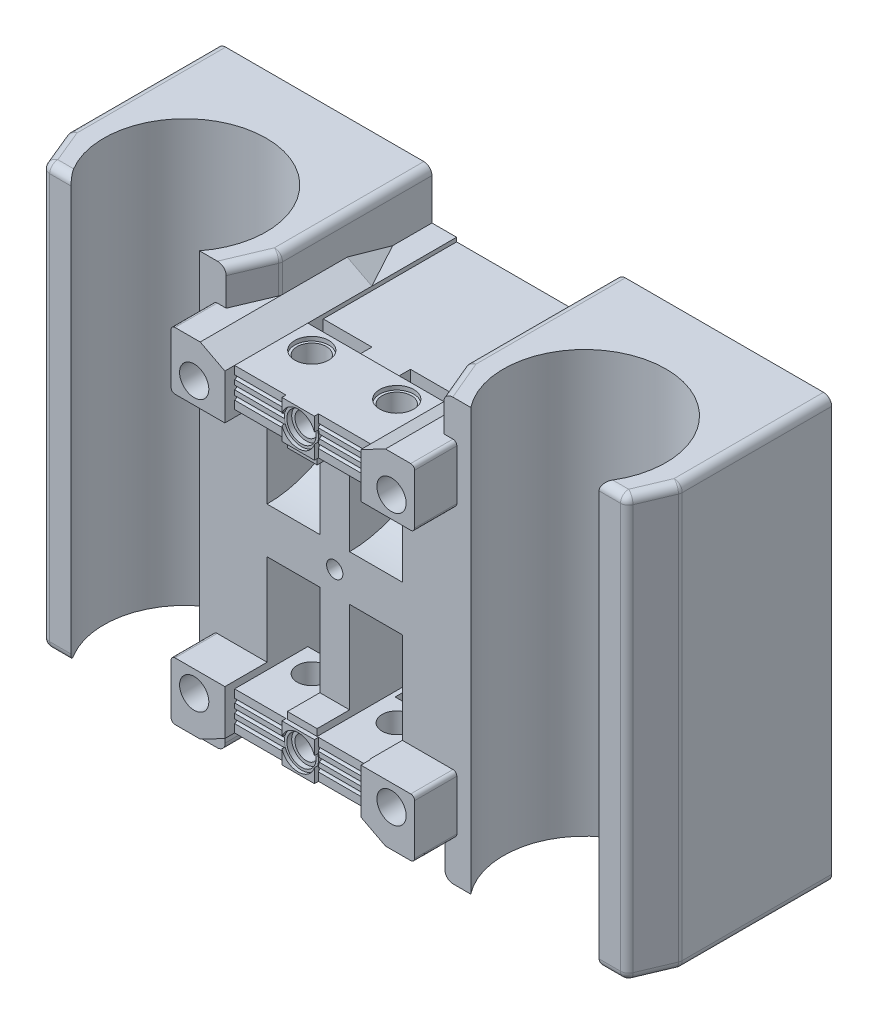
from build123d import *

# Parameters (mm, degrees)
BOSS_EXTRUDE1_DEPTH     = 300
SKETCH3_W               = 65
SKETCH3_H               = 5
CUT_EXTRUDE1_DEPTH      = 7
SKETCH4_R               = 10
SKETCH4_R_2             = 14
SKETCH4_W               = 65
SKETCH4_H               = 120.911733939
CUT_EXTRUDE2_DEPTH      = 200
BOSS_EXTRUDE2_DEPTH     = 12
CUT_EXTRUDE4_DEPTH      = 1618.985651132
CUT_EXTRUDE4_DEPTH_BACK = 1618.985651132
SKETCH8_R               = 18
SKETCH9_W               = 40
SKETCH9_H               = 47
SKETCH9_R               = 19.5
BOSS_EXTRUDE6_DEPTH     = 5
SKETCH10_R              = 21
CUT_EXTRUDE6_DEPTH      = 10
SKETCH12_W              = 40
SKETCH12_H              = 281.169421229
CUT_EXTRUDE7_DEPTH      = 664
SKETCH13_W              = 184.056183541
SKETCH13_H              = 44.770423024
SKETCH13_W_2            = 184.056183542
CUT_EXTRUDE8_DEPTH      = 40
CUT_EXTRUDE9_START      = -40
CUT_EXTRUDE9_DEPTH      = 40
CUT_EXTRUDE10_START     = -40
CUT_EXTRUDE10_DEPTH     = 40
SKETCH17_W              = 260
SKETCH17_H              = 519.04990449
BOSS_EXTRUDE8_DEPTH     = 80
SKETCH18_W              = 260
SKETCH18_H              = 519.04990449
BOSS_EXTRUDE9_DEPTH     = 80
CUT_EXTRUDE13_DEPTH     = 44.770423024
CUT_EXTRUDE14_DEPTH     = 44.770423024
CUT_EXTRUDE15_DEPTH     = 1555.226022996
CUT_EXTRUDE18_DEPTH     = 1555.226022996
SKETCH21_W              = 260
SKETCH21_H              = 46.726362612
BOSS_EXTRUDE10_DEPTH    = 10
SKETCH22_W              = 260
SKETCH22_H              = 46.726362612
BOSS_EXTRUDE11_DEPTH    = 10
SKETCH23_W              = 167.481150758
SKETCH23_H              = 209.837877549
CUT_EXTRUDE19_DEPTH     = 5
SKETCH24_R              = 18
CUT_EXTRUDE20_DEPTH     = 425
SKETCH25_R              = 21
CUT_EXTRUDE21_DEPTH     = 5
CUT_EXTRUDE22_START     = -5
SKETCH26_R              = 21
CUT_EXTRUDE22_DEPTH     = 5
BOSS_EXTRUDE12_START    = 6
SKETCH28_R              = 21
SKETCH28_R_2            = 18
BOSS_EXTRUDE12_DEPTH    = 6
BOSS_EXTRUDE13_START    = 6
SKETCH29_R              = 21
SKETCH29_R_2            = 18
BOSS_EXTRUDE13_DEPTH    = 6
SKETCH30_R              = 10
CUT_EXTRUDE23_DEPTH     = 1672.95786284
CUT_EXTRUDE24_DEPTH     = 131
SKETCH33_W              = 30.337968043
SKETCH33_H              = 5
BOSS_EXTRUDE14_DEPTH    = 131
SKETCH37_W              = 65
SKETCH37_H              = 160
BOSS_EXTRUDE15_DEPTH    = 56.143010748
BOSS_EXTRUDE17_DEPTH    = 166.601474
SKETCH41_W              = 60.040287367
SKETCH41_H              = 18.955516772
SKETCH41_W_2            = 60.040287366
CUT_EXTRUDE25_DEPTH     = 527
BOSS_EXTRUDE18_DEPTH    = 113.5
SKETCH46_R              = 12.5
CUT_EXTRUDE26_DEPTH     = 15
SKETCH48_R              = 12.5
CUT_EXTRUDE27_DEPTH     = 313
SKETCH49_W              = 756.269453926
SKETCH49_H              = 26.627610499
CUT_EXTRUDE28_DEPTH     = 710
BOSS_EXTRUDE19_REACH    = 1008.136
SKETCH51_R              = 18
CUT_EXTRUDE29_DEPTH     = 6
SKETCH52_R              = 14
CUT_EXTRUDE30_DEPTH     = 150
BOSS_EXTRUDE20_REACH    = 1008.136
SKETCH54_R              = 18
CUT_EXTRUDE31_DEPTH     = 6
SKETCH55_R              = 14
CUT_EXTRUDE32_DEPTH     = 175
FILLET1_R               = 10
FILLET2_R               = 10
FILLET3_R               = 10
FILLET4_R               = 10
FILLET5_R               = 10
FILLET6_R               = 10
FILLET7_R               = 10
FILLET8_R               = 10
FILLET9_R               = 10
FILLET10_R              = 10
FILLET11_R              = 10
FILLET12_R              = 10
FILLET13_R              = 10
FILLET14_R              = 10


with BuildPart() as part:
    # Sketch2 → Boss-Extrude1 (new body)
    with BuildSketch(Plane.XY):
        Polygon((969.509246689, 777.089695661), (1136.990397447, 777.089695661), (1167.32836549, 792.867546452), (1167.32836549, 837.637969476), (1351.384549031, 837.637969476), (1351.384549031, 318.588064986), (1198.532308906, 318.588064986), (1198.532308906, 365.314427598), (1173.137546617, 365.314427598), (1136.990397447, 385.122342183), (969.509246689, 385.122342183), (933.362097519, 365.314427598), (907.967335231, 365.314427598), (907.967335231, 318.588064986), (755.115095105, 318.588064986), (755.115095105, 837.637969476), (939.171278647, 837.637969476), (939.171278647, 792.867546452), align=None)
    extrude(amount=BOSS_EXTRUDE1_DEPTH)

    # Sketch3 → Cut-Extrude1 (cut)
    with BuildSketch(Plane.XY.offset(300)):
        with Locations((1002.009246689, 764.589695661)):
            Rectangle(SKETCH3_W, SKETCH3_H)
        with Locations((1002.009246689, 753.589695661)):
            Rectangle(SKETCH3_W, SKETCH3_H)
        with Locations((1002.009246689, 742.589695661)):
            Rectangle(SKETCH3_W, SKETCH3_H)
        with Locations((1002.009246689, 419.622342183)):
            Rectangle(SKETCH3_W, SKETCH3_H)
        with Locations((1002.009246689, 408.622342183)):
            Rectangle(SKETCH3_W, SKETCH3_H)
        with Locations((1002.009246689, 397.622342183)):
            Rectangle(SKETCH3_W, SKETCH3_H)
        with Locations((1104.490397447, 742.589695661)):
            Rectangle(SKETCH3_W, SKETCH3_H)
        with Locations((1104.490397447, 753.589695661)):
            Rectangle(SKETCH3_W, SKETCH3_H)
        with Locations((1104.490397447, 764.589695661)):
            Rectangle(SKETCH3_W, SKETCH3_H)
        with Locations((1104.490397447, 397.622342183)):
            Rectangle(SKETCH3_W, SKETCH3_H)
        with Locations((1104.490397447, 408.622342183)):
            Rectangle(SKETCH3_W, SKETCH3_H)
        with Locations((1104.490397447, 419.622342183)):
            Rectangle(SKETCH3_W, SKETCH3_H)
    extrude(amount=-CUT_EXTRUDE1_DEPTH, mode=Mode.SUBTRACT)

    # Sketch4 → Cut-Extrude2 (cut)
    with BuildSketch(Plane.XY.offset(300)):
        with Locations((1052.809983699, 581.106018922)):
            Circle(SKETCH4_R)
        with Locations((1052.809983699, 753.589695661)):
            Circle(SKETCH4_R_2)
        with Locations(Location((1052.809983699, 408.622342183, 0), (0, 0, 180))):
            Circle(SKETCH4_R_2)
        with Locations((1002.009246689, 669.633391265)):
            Rectangle(SKETCH4_W, SKETCH4_H)
        with Locations((1002.009246689, 492.578646579)):
            Rectangle(SKETCH4_W, SKETCH4_H)
        with Locations((1103.610720709, 492.578646579)):
            Rectangle(SKETCH4_W, SKETCH4_H)
        with Locations((1103.610720709, 669.633391265)):
            Rectangle(SKETCH4_W, SKETCH4_H)
    extrude(amount=-CUT_EXTRUDE2_DEPTH, mode=Mode.SUBTRACT)

    # Sketch7 → Boss-Extrude2 (add)
    with BuildSketch(Plane.XY.offset(300)):
        with BuildLine():
            Line((969.509246689, 777.089695661), (939.171278647, 792.867546452))
            Line((939.171278647, 792.867546452), (908.104391404, 792.867546452))
            ThreePointArc((908.104391404, 792.867546452), (904.728387769, 791.46915996), (903.330001277, 788.093156325))
            Line((903.330001277, 788.093156325), (903.330001277, 726.465119664))
            ThreePointArc((903.330001277, 726.465119664), (904.728387769, 723.089116029), (908.104391404, 721.690729537))
            Line((908.104391404, 721.690729537), (969.509246689, 721.690729537))
            Line((969.509246689, 721.690729537), (969.509246689, 777.089695661))
        make_face()
        with BuildLine():
            Line((1136.990397447, 777.089695661), (1167.32836549, 792.867546452))
            Line((1167.32836549, 792.867546452), (1198.395252733, 792.867546452))
            ThreePointArc((1198.395252733, 792.867546452), (1201.771256368, 791.46915996), (1203.16964286, 788.093156325))
            Line((1203.16964286, 788.093156325), (1203.16964286, 726.465119664))
            ThreePointArc((1203.16964286, 726.465119664), (1201.771256368, 723.089116029), (1198.395252733, 721.690729537))
            Line((1198.395252733, 721.690729537), (1136.990397447, 721.690729537))
            Line((1136.990397447, 721.690729537), (1136.990397447, 777.089695661))
        make_face()
        with BuildLine():
            Line((1136.990397447, 440.521308308), (1136.990397447, 385.122342183))
            Line((1136.990397447, 385.122342183), (1167.32836549, 369.344491392))
            Line((1167.32836549, 369.344491392), (1198.395252733, 369.344491392))
            ThreePointArc((1198.395252733, 369.344491392), (1201.771256368, 370.742877884), (1203.16964286, 374.118881519))
            Line((1203.16964286, 374.118881519), (1203.16964286, 435.74691818))
            ThreePointArc((1203.16964286, 435.74691818), (1201.771256368, 439.122921815), (1198.395252733, 440.521308308))
            Line((1198.395252733, 440.521308308), (1136.990397447, 440.521308308))
        make_face()
        with BuildLine():
            Line((903.330001277, 374.118881519), (903.330001277, 435.74691818))
            ThreePointArc((903.330001277, 435.74691818), (904.728387769, 439.122921815), (908.104391404, 440.521308308))
            Line((908.104391404, 440.521308308), (969.509246689, 440.521308308))
            Line((969.509246689, 440.521308308), (969.509246689, 385.122342183))
            Line((969.509246689, 385.122342183), (939.171278647, 369.344491392))
            Line((939.171278647, 369.344491392), (908.104391404, 369.344491392))
            ThreePointArc((908.104391404, 369.344491392), (904.728387769, 370.742877884), (903.330001277, 374.118881519))
        make_face()
    extrude(amount=BOSS_EXTRUDE2_DEPTH)

    # Sketch8 → Cut-Extrude4 (cut, two sides: drawn at the far end of the back side and taken through both)
    with BuildSketch(Plane.XY.offset(300).offset(-CUT_EXTRUDE4_DEPTH_BACK)):
        with Locations((931.755805763, 747.752371261)):
            Circle(SKETCH8_R)
        with Locations(Location((931.755805763, 414.459666584, 0), (0, 0, 180))):
            Circle(SKETCH8_R)
        with Locations((1174.743838374, 414.459666584)):
            Circle(SKETCH8_R)
        with Locations(Location((1174.743838374, 747.752371261, 0), (0, 0, 180))):
            Circle(SKETCH8_R)
    extrude(amount=CUT_EXTRUDE4_DEPTH + CUT_EXTRUDE4_DEPTH_BACK, mode=Mode.SUBTRACT)

    # Sketch9 → Boss-Extrude6 (add)
    # profile 1 of 2: a face of its own
    with BuildSketch(Plane.XY.offset(300)):
        with Locations((1052.809983699, 753.589695661)):
            Rectangle(SKETCH9_W, SKETCH9_H)
        with Locations(Location((1052.809983699, 753.589695661, 0), (0, 0, 172.634114171))):
            Circle(SKETCH9_R, mode=Mode.SUBTRACT)
    # profile 2 of 2: a face of its own
    with BuildSketch(Plane.XY.offset(300)):
        with Locations((1052.809983699, 408.622342183)):
            Rectangle(SKETCH9_W, SKETCH9_H)
        with Locations(Location((1052.809983699, 408.622342183, 0), (0, 0, 172.634114171))):
            Circle(SKETCH9_R, mode=Mode.SUBTRACT)
    extrude(amount=BOSS_EXTRUDE6_DEPTH)

    # Sketch10 → Cut-Extrude6 (cut)
    with BuildSketch(Plane.XY.offset(305)):
        with Locations((1052.809983699, 753.589695661)):
            Circle(SKETCH10_R)
        with Locations((1052.809983699, 408.622342183)):
            Circle(SKETCH10_R)
    extrude(amount=-CUT_EXTRUDE6_DEPTH, mode=Mode.SUBTRACT)

    # Sketch12 → Cut-Extrude7 (cut)
    with BuildSketch(Plane(origin=(1351.384549031, 0, 0), x_dir=(0, 0, -1), z_dir=(1, 0, 0))):
        with Locations((-280, 581.106018922)):
            Rectangle(SKETCH12_W, SKETCH12_H)
    extrude(amount=-CUT_EXTRUDE7_DEPTH, mode=Mode.SUBTRACT)

    # Sketch13 → Cut-Extrude8 (cut)
    with BuildSketch(Plane.XY.offset(300)):
        with Locations((1259.356457261, 815.252757964)):
            Rectangle(SKETCH13_W, SKETCH13_H)
        with Locations((847.143186876, 815.252757964)):
            Rectangle(SKETCH13_W_2, SKETCH13_H)
    extrude(amount=-CUT_EXTRUDE8_DEPTH, mode=Mode.SUBTRACT)

    # Sketch14 → Cut-Extrude9 (cut)
    with BuildSketch(Plane.XY.offset(300).offset(CUT_EXTRUDE9_START)):
        with BuildLine():
            Line((908.104391404, 792.867546452), (755.115095105, 792.867546452))
            Line((755.115095105, 792.867546452), (755.115095105, 721.690729537))
            Line((755.115095105, 721.690729537), (908.104391404, 721.690729537))
            ThreePointArc((908.104391404, 721.690729537), (904.728387769, 723.089116029), (903.330001277, 726.465119664))
            Line((903.330001277, 726.465119664), (903.330001277, 788.093156325))
            ThreePointArc((903.330001277, 788.093156325), (904.728387769, 791.46915996), (908.104391404, 792.867546452))
        make_face()
        with BuildLine():
            Line((1351.384549031, 721.690729537), (1351.384549031, 792.867546452))
            Line((1351.384549031, 792.867546452), (1198.395252733, 792.867546452))
            ThreePointArc((1198.395252733, 792.867546452), (1201.771256368, 791.46915996), (1203.16964286, 788.093156325))
            Line((1203.16964286, 788.093156325), (1203.16964286, 726.465119664))
            ThreePointArc((1203.16964286, 726.465119664), (1201.771256368, 723.089116029), (1198.395252733, 721.690729537))
            Line((1198.395252733, 721.690729537), (1351.384549031, 721.690729537))
        make_face()
    extrude(amount=CUT_EXTRUDE9_DEPTH, mode=Mode.SUBTRACT)

    # Sketch15 → Cut-Extrude10 (cut)
    with BuildSketch(Plane.XY.offset(300).offset(CUT_EXTRUDE10_START)):
        with BuildLine():
            Line((908.104391404, 440.521308308), (755.115095105, 440.521308308))
            Line((755.115095105, 440.521308308), (755.115095105, 318.588064986))
            Line((755.115095105, 318.588064986), (907.967335231, 318.588064986))
            Line((907.967335231, 318.588064986), (907.967335231, 365.314427598))
            Line((907.967335231, 365.314427598), (933.362097519, 365.314427598))
            Line((933.362097519, 365.314427598), (969.509246689, 385.122342183))
            Line((969.509246689, 385.122342183), (939.171278647, 369.344491392))
            Line((939.171278647, 369.344491392), (908.104391404, 369.344491392))
            ThreePointArc((908.104391404, 369.344491392), (904.728387769, 370.742877884), (903.330001277, 374.118881519))
            Line((903.330001277, 374.118881519), (903.330001277, 435.74691818))
            ThreePointArc((903.330001277, 435.74691818), (904.728387769, 439.122921815), (908.104391404, 440.521308308))
        make_face()
        with BuildLine():
            Line((1198.395252733, 440.521308308), (1351.384549031, 440.521308308))
            Line((1351.384549031, 440.521308308), (1351.384549031, 318.588064986))
            Line((1351.384549031, 318.588064986), (1198.532308906, 318.588064986))
            Line((1198.532308906, 318.588064986), (1198.532308906, 365.314427598))
            Line((1198.532308906, 365.314427598), (1173.137546617, 365.314427598))
            Line((1173.137546617, 365.314427598), (1136.990397447, 385.122342183))
            Line((1136.990397447, 385.122342183), (1167.32836549, 369.344491392))
            Line((1167.32836549, 369.344491392), (1198.532308906, 369.346459001))
            ThreePointArc((1198.532308906, 369.346459001), (1201.859414357, 370.752776724), (1203.16964286, 374.118881519))
            Line((1203.16964286, 374.118881519), (1203.16964286, 435.74691818))
            ThreePointArc((1203.16964286, 435.74691818), (1201.771256368, 439.122921815), (1198.395252733, 440.521308308))
        make_face()
    extrude(amount=CUT_EXTRUDE10_DEPTH, mode=Mode.SUBTRACT)

    # Sketch17 → Boss-Extrude8 (add)
    with BuildSketch(Plane.ZY.offset(-755.115095105)):
        with Locations((130, 578.113017231)):
            Rectangle(SKETCH17_W, SKETCH17_H)
    extrude(amount=BOSS_EXTRUDE8_DEPTH)

    # Sketch18 → Boss-Extrude9 (add)
    with BuildSketch(Plane(origin=(1351.384549031, 0, 0), x_dir=(0, 0, -1), z_dir=(1, 0, 0))):
        with Locations((-130, 578.113017231)):
            Rectangle(SKETCH18_W, SKETCH18_H)
    extrude(amount=BOSS_EXTRUDE9_DEPTH)

    # Sketch20 → Cut-Extrude13 (cut)
    with BuildSketch(Plane(origin=(0, 837.637969476, 0), x_dir=(1, 0, 0), z_dir=(0, 1, 0))):
        Polygon((1167.32836549, -212.654460462), (1167.32836549, -260), (1187.32836549, -260), align=None)
    extrude(amount=-CUT_EXTRUDE13_DEPTH, mode=Mode.SUBTRACT)

    # Sketch19 → Cut-Extrude14 (cut)
    with BuildSketch(Plane(origin=(0, 837.637969476, 0), x_dir=(1, 0, 0), z_dir=(0, 1, 0))):
        Polygon((939.171278647, -260), (939.171278647, -212.654460462), (919.171278647, -260), align=None)
    extrude(amount=-CUT_EXTRUDE14_DEPTH, mode=Mode.SUBTRACT)

    # Sketch19<6> → Cut-Extrude15 (cut, through all)
    with BuildSketch(Plane(origin=(0, 837.637969476, 0), x_dir=(1, 0, 0), z_dir=(0, 1, 0))):
        Polygon((675.115095105, -260), (695.115095105, -260), (675.115095105, -211.570176148), align=None)
        Polygon((1431.384549031, -260), (1431.384549031, -212.654460462), (1411.384549031, -260), align=None)
    extrude(amount=-CUT_EXTRUDE15_DEPTH, mode=Mode.SUBTRACT)

    # Sketch19<9> → Cut-Extrude18 (cut, through all)
    with BuildSketch(Plane(origin=(0, 837.637969476, 0), x_dir=(1, 0, 0), z_dir=(0, 1, 0))):
        with BuildLine():
            ThreePointArc((728.115095105, -260), (807.143186876, -298.722515255), (886.171278647, -260))
            Line((886.171278647, -260), (807.143186876, -260))
            Line((807.143186876, -260), (728.115095105, -260))
        make_face()
        with BuildLine():
            Line((807.143186876, -260), (886.171278647, -260))
            ThreePointArc((886.171278647, -260), (901.758566731, -231.104222991), (907.147957042, -198.71774509))
            ThreePointArc((907.147957042, -198.71774509), (774.756708975, -104.102365235), (728.115095105, -260))
            Line((728.115095105, -260), (807.143186876, -260))
        make_face()
        with BuildLine():
            ThreePointArc((1399.361227426, -198.71774509), (1266.969979359, -104.102365235), (1220.32836549, -260))
            Line((1220.32836549, -260), (1299.356457261, -260))
            Line((1299.356457261, -260), (1378.384549031, -260))
            ThreePointArc((1378.384549031, -260), (1393.971837115, -231.104222991), (1399.361227426, -198.71774509))
        make_face()
        with BuildLine():
            Line((1299.356457261, -260), (1220.32836549, -260))
            ThreePointArc((1220.32836549, -260), (1299.356457261, -298.722515255), (1378.384549031, -260))
            Line((1378.384549031, -260), (1299.356457261, -260))
        make_face()
    extrude(amount=-CUT_EXTRUDE18_DEPTH, mode=Mode.SUBTRACT)

    # Sketch21 → Boss-Extrude10 (add)
    with BuildSketch(Plane(origin=(907.967335231, 0, 0), x_dir=(0, 0, -1), z_dir=(1, 0, 0))):
        with Locations((-130, 341.951246292)):
            Rectangle(SKETCH21_W, SKETCH21_H)
    extrude(amount=BOSS_EXTRUDE10_DEPTH)

    # Sketch22 → Boss-Extrude11 (add)
    with BuildSketch(Plane.ZY.offset(-1198.532308906)):
        with Locations((130, 341.951246292)):
            Rectangle(SKETCH22_W, SKETCH22_H)
    extrude(amount=BOSS_EXTRUDE11_DEPTH)

    # Sketch23 → Cut-Extrude19 (cut)
    with BuildSketch(Plane(origin=(0, 777.089695661, 0), x_dir=(1, 0, 0), z_dir=(0, 1, 0))):
        with Locations((1053.249822068, -104.918938775)):
            Rectangle(SKETCH23_W, SKETCH23_H)
    extrude(amount=-CUT_EXTRUDE19_DEPTH, mode=Mode.SUBTRACT)

    # Sketch24 → Cut-Extrude20 (cut)
    with BuildSketch(Plane(origin=(0, 777.089695661, 0), x_dir=(1, 0, 0), z_dir=(0, 1, 0))):
        with Locations(Location((1000.930890176, -236.374897323, 0), (0, 0, 270))):
            Circle(SKETCH24_R)
        with Locations(Location((1105.568753961, -236.374897323, 0), (0, 0, 270))):
            Circle(SKETCH24_R)
    extrude(amount=-CUT_EXTRUDE20_DEPTH, mode=Mode.SUBTRACT)

    # Sketch25 → Cut-Extrude21 (cut)
    with BuildSketch(Plane(origin=(0, 777.089695661, 0), x_dir=(1, 0, 0), z_dir=(0, 1, 0))):
        with Locations(Location((1000.930890176, -236.374897323, 0), (0, 0, 270))):
            Circle(SKETCH25_R)
        with Locations(Location((1105.568753961, -236.374897323, 0), (0, 0, 270))):
            Circle(SKETCH25_R)
    extrude(amount=-CUT_EXTRUDE21_DEPTH, mode=Mode.SUBTRACT)

    # Sketch26 → Cut-Extrude22 (cut)
    with BuildSketch(Plane.XZ.offset(-385.122342183).offset(CUT_EXTRUDE22_START)):
        with Locations(Location((1000.930890176, 236.374897323, 0), (0, 0, 90))):
            Circle(SKETCH26_R)
        with Locations(Location((1105.568753961, 236.374897323, 0), (0, 0, 90))):
            Circle(SKETCH26_R)
    extrude(amount=CUT_EXTRUDE22_DEPTH, mode=Mode.SUBTRACT)

    # Sketch28 → Boss-Extrude12 (add)
    with BuildSketch(Plane.XY.offset(295).offset(BOSS_EXTRUDE12_START)):
        with Locations((1052.809983699, 408.622342183)):
            Circle(SKETCH28_R)
        with Locations((1052.809983699, 408.622342183)):
            Circle(SKETCH28_R_2, mode=Mode.SUBTRACT)
    extrude(amount=-BOSS_EXTRUDE12_DEPTH)

    # Sketch29 → Boss-Extrude13 (add)
    with BuildSketch(Plane.XY.offset(295).offset(BOSS_EXTRUDE13_START)):
        with Locations((1052.809983699, 753.589695661)):
            Circle(SKETCH29_R)
        with Locations((1052.809983699, 753.589695661)):
            Circle(SKETCH29_R_2, mode=Mode.SUBTRACT)
    extrude(amount=-BOSS_EXTRUDE13_DEPTH)

    # Sketch30 → Cut-Extrude23 (cut, through all)
    with BuildSketch(Plane.XY.offset(100)):
        with Locations((1052.809983699, 581.106018922)):
            Circle(SKETCH30_R)
    extrude(amount=-CUT_EXTRUDE23_DEPTH, mode=Mode.SUBTRACT)

    # Sketch31 → Cut-Extrude24 (cut)
    with BuildSketch(Plane(origin=(0, 0, 0), x_dir=(-1, 0, 0), z_dir=(0, 0, -1))):
        Polygon((-939.171278647, 792.867546452), (-969.509246689, 777.089695661), (-969.509246689, 772.089695661), (-939.171278647, 772.089695661), align=None)
        Polygon((-1167.32836549, 792.867546452), (-1167.32836549, 772.089695661), (-1136.990397447, 772.089695661), (-1136.990397447, 777.089695661), align=None)
    extrude(amount=-CUT_EXTRUDE24_DEPTH, mode=Mode.SUBTRACT)

    # Sketch33 → Boss-Extrude14 (add)
    with BuildSketch(Plane(origin=(0, 0, 131), x_dir=(-1, 0, 0), z_dir=(0, 0, -1))):
        Polygon((-969.509246689, 777.089695661), (-939.041706578, 777.089695661), (-939.171278647, 772.089695661), (-969.509246689, 772.089695661), align=None)
        with Locations((-1152.159381469, 774.589695661)):
            Rectangle(SKETCH33_W, SKETCH33_H)
    extrude(amount=BOSS_EXTRUDE14_DEPTH)

    # Sweep1: sweep along a curve in space
    with BuildLine() as sweep1_path:
        Line((1136.990397447, 777.089695661, 131), (1167.32836549, 792.867546452, 131))
    # Sketch35 → Sweep1 (sweep)
    with BuildSketch(Plane.ZY.offset(-1167.32836549)):
        Polygon((131, 792.867546452), (75, 777.089695661), (131, 777.089695661), align=None)
    sweep(path=sweep1_path.line)

    # Sweep2: sweep along a curve in space
    with BuildLine() as sweep2_path:
        Line((939.171278647, 792.867546452, 131), (969.509246689, 777.089695661, 131))
    # Sketch36 → Sweep2 (sweep)
    with BuildSketch(Plane(origin=(939.171278647, 0, 0), x_dir=(0, 0, -1), z_dir=(1, 0, 0))):
        Polygon((-131, 777.089695661), (-75, 777.089695661), (-131, 792.867546452), align=None)
    sweep(path=sweep2_path.line)

    # Sketch37 → Boss-Extrude15 (add)
    with BuildSketch(Plane(origin=(0, 609.177524296, 0), x_dir=(1, 0, 0), z_dir=(0, 1, 0))):
        with Locations((1002.009246689, -180)):
            Rectangle(SKETCH37_W, SKETCH37_H)
        with Locations((1103.610720709, -180)):
            Rectangle(SKETCH37_W, SKETCH37_H)
    extrude(amount=-BOSS_EXTRUDE15_DEPTH)

    # Sketch40 → Boss-Extrude17 (add)
    with BuildSketch(Plane.ZY.offset(-1136.110720709)):
        with BuildLine():
            Line((100, 730.089258235), (100, 609.177524296))
            Line((100, 609.177524296), (260, 609.177524296))
            ThreePointArc((260, 609.177524296), (202.665030811, 622.448052463), (156.991513782, 659.560522765))
            Line((156.991513782, 659.560522765), (156.991513782, 730.089258235))
            Line((156.991513782, 730.089258235), (100, 730.089258235))
        make_face()
        with BuildLine():
            ThreePointArc((260, 553.034513548), (202.665030811, 539.763985381), (156.991513782, 502.651515079))
            Line((156.991513782, 502.651515079), (156.991513782, 432.122779609))
            Line((156.991513782, 432.122779609), (100, 432.122779609))
            Line((100, 432.122779609), (100, 553.034513548))
            Line((100, 553.034513548), (260, 553.034513548))
        make_face()
    extrude(amount=BOSS_EXTRUDE17_DEPTH)

    # Sketch41 → Cut-Extrude25 (cut)
    with BuildSketch(Plane(origin=(0, 772.089695661, 0), x_dir=(1, 0, 0), z_dir=(0, 1, 0))):
        with Locations((999.529390373, -200.360119163)):
            Rectangle(SKETCH41_W, SKETCH41_H)
        with Locations((1106.970253764, -200.360119163)):
            Rectangle(SKETCH41_W_2, SKETCH41_H)
    extrude(amount=-CUT_EXTRUDE25_DEPTH, mode=Mode.SUBTRACT)

    # Sketch42 → Boss-Extrude18 (add, symmetric)
    with BuildSketch(Plane.ZY.offset(-1029.549534056)):
        with BuildLine():
            Line((190.882360777, 628.985609169), (190.882360777, 533.226428675))
            ThreePointArc((190.882360777, 533.226428675), (200.159920416, 538.505171257), (209.837877549, 543.007990578))
            Line((209.837877549, 543.007990578), (209.837877549, 619.204047266))
            ThreePointArc((209.837877549, 619.204047266), (200.159920416, 623.706866588), (190.882360777, 628.985609169))
        make_face()
    extrude(amount=BOSS_EXTRUDE18_DEPTH, both=True)

    # Sketch46 → Cut-Extrude26 (cut)
    # profile 1 of 2: a face of its own
    with BuildSketch(Plane.XY.offset(156.991513782)):
        Polygon((981.006562702, 708.832664016), (981.319121629, 685.834787877), (1001.392146061, 674.606533777), (1021.152611568, 686.376155817), (1020.840052642, 709.374031957), (1000.767028209, 720.602286056), align=None)
        with Locations((1001.079587135, 697.604409917)):
            Circle(SKETCH46_R, mode=Mode.SUBTRACT)
    # profile 2 of 2: a face of its own
    with BuildSketch(Plane.XY.offset(156.991513782)):
        Polygon((1001.392146061, 487.605495589), (1021.152611568, 475.835873549), (1020.840052642, 452.83799741), (1000.767028209, 441.60974331), (981.006562702, 453.37936535), (981.319121629, 476.377241489), align=None)
        with Locations((1001.079587135, 464.607619449)):
            Circle(SKETCH46_R, mode=Mode.SUBTRACT)
    extrude(amount=-CUT_EXTRUDE26_DEPTH, mode=Mode.SUBTRACT)

    # Sketch48 → Cut-Extrude27 (cut)
    with BuildSketch(Plane.XY.offset(156.991513782)):
        with Locations((1001.079587135, 697.604409917)):
            Circle(SKETCH48_R)
        with Locations((1001.079587135, 464.607619449)):
            Circle(SKETCH48_R)
    extrude(amount=-CUT_EXTRUDE27_DEPTH, mode=Mode.SUBTRACT)

    # Sketch49 → Cut-Extrude28 (cut)
    with BuildSketch(Plane(origin=(0, 837.637969476, 0), x_dir=(1, 0, 0), z_dir=(0, 1, 0))):
        with Locations((1053.249822068, -13.31380525)):
            Rectangle(SKETCH49_W, SKETCH49_H)
    extrude(amount=-CUT_EXTRUDE28_DEPTH, mode=Mode.SUBTRACT)

    # Boss-Extrude19: up to this face of the body (flat: up to its plane)
    boss_extrude19_end = Plane(part.part.faces().sort_by_distance((1136.990397447, 749.963027393, 304.704188001))[0])
    # Sketch50 → Boss-Extrude19 (add, up to the picked face)
    with BuildSketch(Plane(origin=(969.509246689, 0, 0), x_dir=(0, 0, -1), z_dir=(1, 0, 0)), mode=Mode.PRIVATE) as boss_extrude19_sk1:
        with BuildLine():
            Line((-300, 767.089695661), (-293, 767.089695661))
            Line((-293, 767.089695661), (-293, 762.089695661))
            Line((-293, 762.089695661), (-300, 762.089695661))
            ThreePointArc((-300, 762.089695661), (-297.5, 764.589695661), (-300, 767.089695661))
        make_face()
    boss_extrude19_tool1 = split(extrude(boss_extrude19_sk1.sketch, amount=BOSS_EXTRUDE19_REACH, mode=Mode.PRIVATE), bisect_by=boss_extrude19_end, keep=Keep.BOTH, mode=Mode.PRIVATE)
    # Sketch50 → Boss-Extrude19 (add, up to the picked face)
    with BuildSketch(Plane(origin=(969.509246689, 0, 0), x_dir=(0, 0, -1), z_dir=(1, 0, 0)), mode=Mode.PRIVATE) as boss_extrude19_sk2:
        with BuildLine():
            Line((-300, 756.089695661), (-293, 756.089695661))
            Line((-293, 756.089695661), (-293, 751.089695661))
            Line((-293, 751.089695661), (-300, 751.089695661))
            ThreePointArc((-300, 751.089695661), (-297.5, 753.589695661), (-300, 756.089695661))
        make_face()
    boss_extrude19_tool2 = split(extrude(boss_extrude19_sk2.sketch, amount=BOSS_EXTRUDE19_REACH, mode=Mode.PRIVATE), bisect_by=boss_extrude19_end, keep=Keep.BOTH, mode=Mode.PRIVATE)
    # Sketch50 → Boss-Extrude19 (add, up to the picked face)
    with BuildSketch(Plane(origin=(969.509246689, 0, 0), x_dir=(0, 0, -1), z_dir=(1, 0, 0)), mode=Mode.PRIVATE) as boss_extrude19_sk3:
        with BuildLine():
            Line((-300, 745.089695661), (-293, 745.089695661))
            Line((-293, 745.089695661), (-293, 740.089695661))
            Line((-293, 740.089695661), (-300, 740.089695661))
            ThreePointArc((-300, 740.089695661), (-297.5, 742.589695661), (-300, 745.089695661))
        make_face()
    boss_extrude19_tool3 = split(extrude(boss_extrude19_sk3.sketch, amount=BOSS_EXTRUDE19_REACH, mode=Mode.PRIVATE), bisect_by=boss_extrude19_end, keep=Keep.BOTH, mode=Mode.PRIVATE)
    add(boss_extrude19_tool1.solids().sort_by(Axis((969.509247, 764.589696, 295.549162), (1, 0, 0)))[0])
    add(boss_extrude19_tool2.solids().sort_by(Axis((969.509247, 753.589696, 295.549162), (1, 0, 0)))[0])
    add(boss_extrude19_tool3.solids().sort_by(Axis((969.509247, 742.589696, 295.549162), (1, 0, 0)))[0])

    # Sketch51 → Cut-Extrude29 (cut)
    with BuildSketch(Plane.XY.offset(301)):
        with Locations((1052.809983699, 753.589695661)):
            Circle(SKETCH51_R)
    extrude(amount=-CUT_EXTRUDE29_DEPTH, mode=Mode.SUBTRACT)

    # Sketch52 → Cut-Extrude30 (cut)
    with BuildSketch(Plane.XY.offset(295)):
        with Locations((1052.809983699, 753.589695661)):
            Circle(SKETCH52_R)
    extrude(amount=-CUT_EXTRUDE30_DEPTH, mode=Mode.SUBTRACT)

    # Boss-Extrude20: up to this face of the body (flat: up to its plane)
    boss_extrude20_end = Plane(part.part.faces().sort_by_distance((1136.990397447, 412.249010452, 304.704188001))[0])
    # Sketch53 → Boss-Extrude20 (add, up to the picked face)
    with BuildSketch(Plane(origin=(969.509246689, 0, 0), x_dir=(0, 0, -1), z_dir=(1, 0, 0)), mode=Mode.PRIVATE) as boss_extrude20_sk1:
        with BuildLine():
            Line((-300, 422.122342183), (-293, 422.122342183))
            Line((-293, 422.122342183), (-293, 417.122342183))
            Line((-293, 417.122342183), (-300, 417.122342183))
            ThreePointArc((-300, 417.122342183), (-297.5, 419.622342183), (-300, 422.122342183))
        make_face()
    boss_extrude20_tool1 = split(extrude(boss_extrude20_sk1.sketch, amount=BOSS_EXTRUDE20_REACH, mode=Mode.PRIVATE), bisect_by=boss_extrude20_end, keep=Keep.BOTH, mode=Mode.PRIVATE)
    # Sketch53 → Boss-Extrude20 (add, up to the picked face)
    with BuildSketch(Plane(origin=(969.509246689, 0, 0), x_dir=(0, 0, -1), z_dir=(1, 0, 0)), mode=Mode.PRIVATE) as boss_extrude20_sk2:
        with BuildLine():
            Line((-300, 411.122342183), (-293, 411.122342183))
            Line((-293, 411.122342183), (-293, 406.122342183))
            Line((-293, 406.122342183), (-300, 406.122342183))
            ThreePointArc((-300, 406.122342183), (-297.5, 408.622342183), (-300, 411.122342183))
        make_face()
    boss_extrude20_tool2 = split(extrude(boss_extrude20_sk2.sketch, amount=BOSS_EXTRUDE20_REACH, mode=Mode.PRIVATE), bisect_by=boss_extrude20_end, keep=Keep.BOTH, mode=Mode.PRIVATE)
    # Sketch53 → Boss-Extrude20 (add, up to the picked face)
    with BuildSketch(Plane(origin=(969.509246689, 0, 0), x_dir=(0, 0, -1), z_dir=(1, 0, 0)), mode=Mode.PRIVATE) as boss_extrude20_sk3:
        with BuildLine():
            Line((-300, 400.122342183), (-293, 400.122342183))
            Line((-293, 400.122342183), (-293, 395.122342183))
            Line((-293, 395.122342183), (-300, 395.122342183))
            ThreePointArc((-300, 395.122342183), (-297.5, 397.622342183), (-300, 400.122342183))
        make_face()
    boss_extrude20_tool3 = split(extrude(boss_extrude20_sk3.sketch, amount=BOSS_EXTRUDE20_REACH, mode=Mode.PRIVATE), bisect_by=boss_extrude20_end, keep=Keep.BOTH, mode=Mode.PRIVATE)
    add(boss_extrude20_tool1.solids().sort_by(Axis((969.509247, 419.622342, 295.549162), (1, 0, 0)))[0])
    add(boss_extrude20_tool2.solids().sort_by(Axis((969.509247, 408.622342, 295.549162), (1, 0, 0)))[0])
    add(boss_extrude20_tool3.solids().sort_by(Axis((969.509247, 397.622342, 295.549162), (1, 0, 0)))[0])

    # Sketch54 → Cut-Extrude31 (cut)
    with BuildSketch(Plane.XY.offset(301)):
        with Locations((1052.809983699, 408.622342183)):
            Circle(SKETCH54_R)
    extrude(amount=-CUT_EXTRUDE31_DEPTH, mode=Mode.SUBTRACT)

    # Sketch55 → Cut-Extrude32 (cut)
    with BuildSketch(Plane.XY.offset(295)):
        with Locations(Location((1052.809983699, 408.622342183, 0), (0, 0, 180))):
            Circle(SKETCH55_R)
    extrude(amount=-CUT_EXTRUDE32_DEPTH, mode=Mode.SUBTRACT)

    # Fillet1
    fillet1_edges = [part.edges().sort_by_distance(p)[0] for p in [
        (675.115095105, 578.113017231, 211.570176148),
    ]]
    fillet(fillet1_edges, radius=FILLET1_R)

    # Fillet2
    fillet2_edges = [part.edges().sort_by_distance(p)[0] for p in [
        (695.115095105, 578.113017231, 260),
    ]]
    fillet(fillet2_edges, radius=FILLET2_R)

    # Fillet3
    # the kernel refuses this fillet: 10 mm, written as the material it takes off along each edge
    with BuildSketch(Plane(origin=(939.171278647, 842.701668861, 212.654460462), x_dir=(0, 0, -1), z_dir=(0, -1, 0))) as fillet3_piece_1_section:
        with BuildLine():
            CenterArc((FILLET3_R * 0.202547975379, -FILLET3_R), FILLET3_R, 90, 22.900473497)
            Line((-FILLET3_R * 0.186583587496, -FILLET3_R * 0.078817810216), (0, 0))
            Line((0, 0), (FILLET3_R * 0.202547975379, 0))
        make_face()
    fillet3_piece_1 = extrude(amount=49.834122408, mode=Mode.PRIVATE)
    fillet3_piece_1 = split(fillet3_piece_1, bisect_by=Plane(origin=(928.866028525, 798.226992364, 212.629610715), z_dir=(0.461401246846129, 0.8871915742436002, 0)), keep=Keep.TOP, mode=Mode.PRIVATE)
    add(fillet3_piece_1, mode=Mode.SUBTRACT)
    with BuildSketch(Plane(origin=(939.171278647, 842.701668861, 212.654460462), x_dir=(0, 0, -1), z_dir=(0, -1, 0))) as fillet3_piece_2_section:
        with BuildLine():
            CenterArc((FILLET3_R * 0.202547975379, -FILLET3_R), FILLET3_R, 90, 22.900473497)
            Line((-FILLET3_R * 0.186583587496, -FILLET3_R * 0.078817810216), (0, 0))
            Line((0, 0), (FILLET3_R * 0.202547975379, 0))
        make_face()
    fillet3_piece_2 = extrude(amount=49.834122408, mode=Mode.PRIVATE)
    fillet3_piece_2 = split(fillet3_piece_2, bisect_by=Plane(origin=(938.794431428, 793.063533184, 213.771352566), z_dir=(-0.461401246846129, -0.8871915742436002, 0)), keep=Keep.TOP, mode=Mode.PRIVATE)
    add(fillet3_piece_2, mode=Mode.SUBTRACT)

    # Fillet4
    # the kernel refuses this fillet: 10 mm, written as the material it takes off along each edge
    with BuildSketch(Plane(origin=(1167.32836549, 842.701668861, 212.654460462), x_dir=(0, 0, -1), z_dir=(0, -1, 0))) as fillet4_piece_1_section:
        with BuildLine():
            CenterArc((FILLET4_R * 0.202547975379, FILLET4_R), FILLET4_R, 247.099526503, 22.900473497)
            Line((-FILLET4_R * 0.186583587496, FILLET4_R * 0.078817810216), (0, 0))
            Line((0, 0), (FILLET4_R * 0.202547975379, 0))
        make_face()
    fillet4_piece_1 = extrude(amount=49.834122408, mode=Mode.PRIVATE)
    fillet4_piece_1 = split(fillet4_piece_1, bisect_by=Plane(origin=(1177.633615612, 798.226992364, 212.629610715), z_dir=(-0.46140124684612493, 0.8871915742436024, 0)), keep=Keep.TOP, mode=Mode.PRIVATE)
    add(fillet4_piece_1, mode=Mode.SUBTRACT)
    with BuildSketch(Plane(origin=(1167.32836549, 842.701668861, 212.654460462), x_dir=(0, 0, -1), z_dir=(0, -1, 0))) as fillet4_piece_2_section:
        with BuildLine():
            CenterArc((FILLET4_R * 0.202547975379, FILLET4_R), FILLET4_R, 247.099526503, 22.900473497)
            Line((-FILLET4_R * 0.186583587496, FILLET4_R * 0.078817810216), (0, 0))
            Line((0, 0), (FILLET4_R * 0.202547975379, 0))
        make_face()
    fillet4_piece_2 = extrude(amount=49.834122408, mode=Mode.PRIVATE)
    fillet4_piece_2 = split(fillet4_piece_2, bisect_by=Plane(origin=(1167.705212709, 793.063533184, 213.771352568), z_dir=(0.46140124684612493, -0.8871915742436024, 0)), keep=Keep.TOP, mode=Mode.PRIVATE)
    add(fillet4_piece_2, mode=Mode.SUBTRACT)

    # Fillet5
    fillet5_edges = [part.edges().sort_by_distance(p)[0] for p in [
        (1411.384549031, 578.113017231, 260),
    ]]
    fillet(fillet5_edges, radius=FILLET5_R)

    # Fillet6
    fillet6_edges = [part.edges().sort_by_distance(p)[0] for p in [
        (1431.384549031, 578.113017231, 212.654460462),
    ]]
    fillet(fillet6_edges, radius=FILLET6_R)

    # Fillet7
    fillet7_edges = [part.edges().sort_by_distance(p)[0] for p in [
        (675.115095105, 837.637969476, 118.107093968),
        (675.306206734, 837.637969476, 211.532267269),
        (684.216975596, 837.637969476, 233.610299593),
        (696.244451509, 837.637969476, 258.311741958),
        (714.959833811, 837.637969476, 260),
    ]]
    fillet(fillet7_edges, radius=FILLET7_R)

    # Fillet8
    fillet8_edges = [part.edges().sort_by_distance(p)[0] for p in [
        (939.171278647, 837.637969476, 118.628295603),
        (938.972253572, 837.637969476, 212.614148336),
        (928.777189596, 837.637969476, 237.260148168),
    ]]
    fillet(fillet8_edges, radius=FILLET8_R)

    # Fillet9
    fillet9_edges = [part.edges().sort_by_distance(p)[0] for p in [
        (1167.32836549, 837.637969476, 118.628295603),
        (1167.527390564, 837.637969476, 212.614148336),
        (1177.722454541, 837.637969476, 237.260148168),
    ]]
    fillet(fillet9_edges, radius=FILLET9_R)

    # Fillet10
    fillet10_edges = [part.edges().sort_by_distance(p)[0] for p in [
        (1431.384549031, 837.637969476, 118.628295603),
        (1391.568872481, 837.637969476, 260),
        (1422.280694379, 837.637969476, 234.205805983),
        (1410.279806271, 837.637969476, 258.334061323),
        (1431.185523957, 837.637969476, 212.614148336),
    ]]
    fillet(fillet10_edges, radius=FILLET10_R)

    # Fillet11
    fillet11_edges = [part.edges().sort_by_distance(p)[0] for p in [
        (1422.280694379, 318.588064986, 234.205805983),
        (1410.279806271, 318.588064986, 258.334061323),
        (1431.384549031, 318.588064986, 118.628295603),
        (1431.185523957, 318.588064986, 212.614148336),
        (1391.568872481, 318.588064986, 260),
    ]]
    fillet(fillet11_edges, radius=FILLET11_R)

    # Fillet12
    fillet12_edges = [part.edges().sort_by_distance(p)[0] for p in [
        (1188.532308906, 318.588064986, 143.313805249),
    ]]
    fillet(fillet12_edges, radius=FILLET12_R)

    # Fillet13
    fillet13_edges = [part.edges().sort_by_distance(p)[0] for p in [
        (917.967335231, 318.588064986, 143.313805249),
    ]]
    fillet(fillet13_edges, radius=FILLET13_R)

    # Fillet14
    fillet14_edges = [part.edges().sort_by_distance(p)[0] for p in [
        (675.115095105, 318.588064986, 118.107093968),
        (675.306206734, 318.588064986, 211.532267269),
        (684.216975596, 318.588064986, 233.610299593),
        (714.959833811, 318.588064986, 260),
        (696.244451509, 318.588064986, 258.311741958),
    ]]
    fillet(fillet14_edges, radius=FILLET14_R)


solid = part.part
